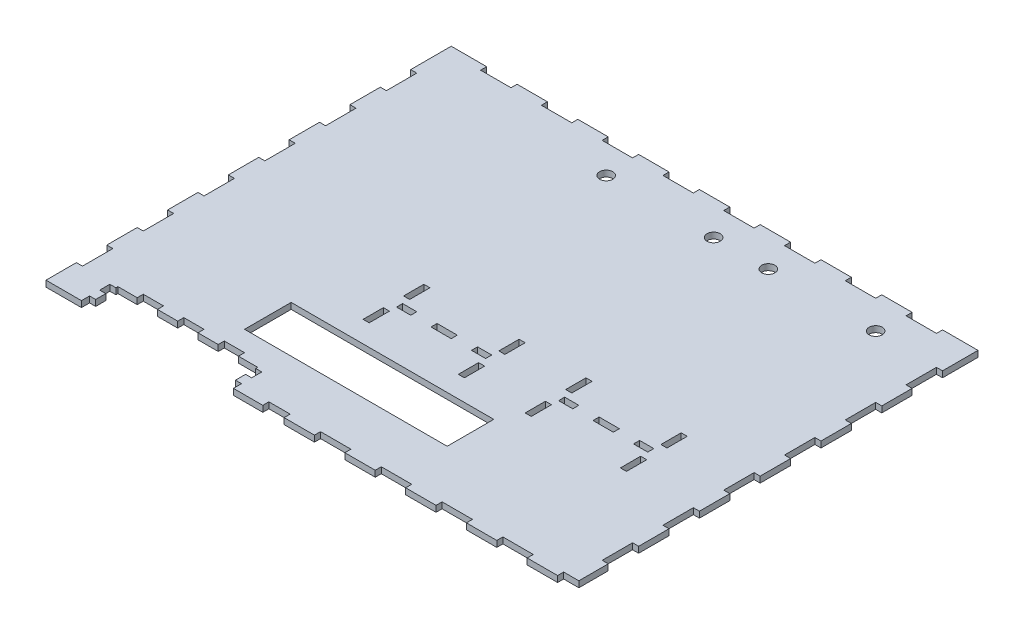
from build123d import *

# Parameters (mm, degrees)
CROQUIS1_R              = 3.25
CROQUIS1_W              = 10
CROQUIS1_H              = 3
CROQUIS1_W_2            = 3
CROQUIS1_H_2            = 10
CROQUIS1_W_3            = 7
SALIENTE_EXTRUIR1_DEPTH = 3


with BuildPart() as part:
    # Croquis1 → Saliente-Extruir1 (new body)
    with BuildSketch(Plane(origin=(0, 0, 0), x_dir=(1, 0, 0), z_dir=(0, 1, 0))):
        Polygon((17.5, 79), (20.5, 79), (20.5, 80), (25.626440042, 80), (30, 80), (30, 83), (40, 83), (40, 80), (50, 80), (50, 83), (60, 83), (60, 80), (70, 80), (70, 83), (80, 83), (80, 80), (84.373559958, 80), (89.5, 80), (89.5, 79), (92.5, 79), (92.5, 74), (89.5, 74), (89.5, 69), (92.5, 69), (92.5, 65), (107, 65), (107, 68), (117.5, 68), (117.5, 65), (132.5, 65), (132.5, 68), (147.5, 68), (147.5, 65), (162.5, 65), (162.5, 68), (177.5, 68), (177.5, 65), (192.5, 65), (192.5, 68), (207.5, 68), (207.5, 65), (222.5, 65), (222.5, 68), (237.5, 68), (237.5, 65), (252.5, 65), (252.5, 68), (260, 68), (260, 82.5), (257, 82.5), (257, 97.5), (260, 97.5), (260, 112.5), (257, 112.5), (257, 127.5), (260, 127.5), (260, 142.5), (257, 142.5), (257, 157.5), (260, 157.5), (260, 172.5), (257, 172.5), (257, 187.5), (260, 187.5), (260, 202.5), (257, 202.5), (257, 217.5), (260, 217.5), (260, 232.5), (257, 232.5), (257, 247.5), (260, 247.5), (260, 265), (242.5, 265), (242.5, 262), (227.5, 262), (227.5, 265), (212.5, 265), (212.5, 262), (197.5, 262), (197.5, 265), (182.5, 265), (182.5, 262), (167.5, 262), (167.5, 265), (152.5, 265), (152.5, 262), (137.5, 262), (137.5, 265), (122.5, 265), (122.5, 262), (107.5, 262), (107.5, 265), (92.5, 265), (92.5, 262), (77.5, 262), (77.5, 265), (62.5, 265), (62.5, 262), (47.5, 262), (47.5, 265), (32.5, 265), (32.5, 262), (17.5, 262), (17.5, 265), (0, 265), (0, 245), (3, 245), (3, 230), (0, 230), (0, 215), (3, 215), (3, 200), (0, 200), (0, 185), (3, 185), (3, 170), (0, 170), (0, 155), (3, 155), (3, 140), (0, 140), (0, 125), (3, 125), (3, 110), (0, 110), (0, 95), (3, 95), (3, 80), (0, 80), (0, 65), (17.5, 65), (17.5, 69), (20.5, 69), (20.5, 74), (17.5, 74), align=None)
        with Locations((173.5, 248)):
            Circle(CROQUIS1_R, mode=Mode.SUBTRACT)
        with Locations((93.5, 248)):
            Circle(CROQUIS1_R, mode=Mode.SUBTRACT)
        with Locations((146.5, 248)):
            Circle(CROQUIS1_R, mode=Mode.SUBTRACT)
        with Locations((226.5, 248)):
            Circle(CROQUIS1_R, mode=Mode.SUBTRACT)
        with Locations((120, 141.5)):
            Rectangle(CROQUIS1_W, CROQUIS1_H, mode=Mode.SUBTRACT)
        Polygon((120, 93), (70, 93), (70, 116), (170, 116), (170, 93), align=None, mode=Mode.SUBTRACT)
        with Locations((200, 141.5)):
            Rectangle(CROQUIS1_W, CROQUIS1_H, mode=Mode.SUBTRACT)
        with Locations((96.5, 151.5)):
            Rectangle(CROQUIS1_W_2, CROQUIS1_H_2, mode=Mode.SUBTRACT)
        with Locations((96.5, 131.5)):
            Rectangle(CROQUIS1_W_2, CROQUIS1_H_2, mode=Mode.SUBTRACT)
        with Locations((101.5, 141.5)):
            Rectangle(CROQUIS1_W_3, CROQUIS1_H, mode=Mode.SUBTRACT)
        with Locations((143.5, 151.5)):
            Rectangle(CROQUIS1_W_2, CROQUIS1_H_2, mode=Mode.SUBTRACT)
        with Locations((143.5, 131.5)):
            Rectangle(CROQUIS1_W_2, CROQUIS1_H_2, mode=Mode.SUBTRACT)
        with Locations((176.5, 151.5)):
            Rectangle(CROQUIS1_W_2, CROQUIS1_H_2, mode=Mode.SUBTRACT)
        with Locations((138.5, 141.5)):
            Rectangle(CROQUIS1_W_3, CROQUIS1_H, mode=Mode.SUBTRACT)
        with Locations((181.5, 141.5)):
            Rectangle(CROQUIS1_W_3, CROQUIS1_H, mode=Mode.SUBTRACT)
        with Locations((223.5, 151.5)):
            Rectangle(CROQUIS1_W_2, CROQUIS1_H_2, mode=Mode.SUBTRACT)
        with Locations((218.5, 141.5)):
            Rectangle(CROQUIS1_W_3, CROQUIS1_H, mode=Mode.SUBTRACT)
        with Locations((176.5, 131.5)):
            Rectangle(CROQUIS1_W_2, CROQUIS1_H_2, mode=Mode.SUBTRACT)
        with Locations((223.5, 131.5)):
            Rectangle(CROQUIS1_W_2, CROQUIS1_H_2, mode=Mode.SUBTRACT)
    extrude(amount=SALIENTE_EXTRUIR1_DEPTH)


solid = part.part
